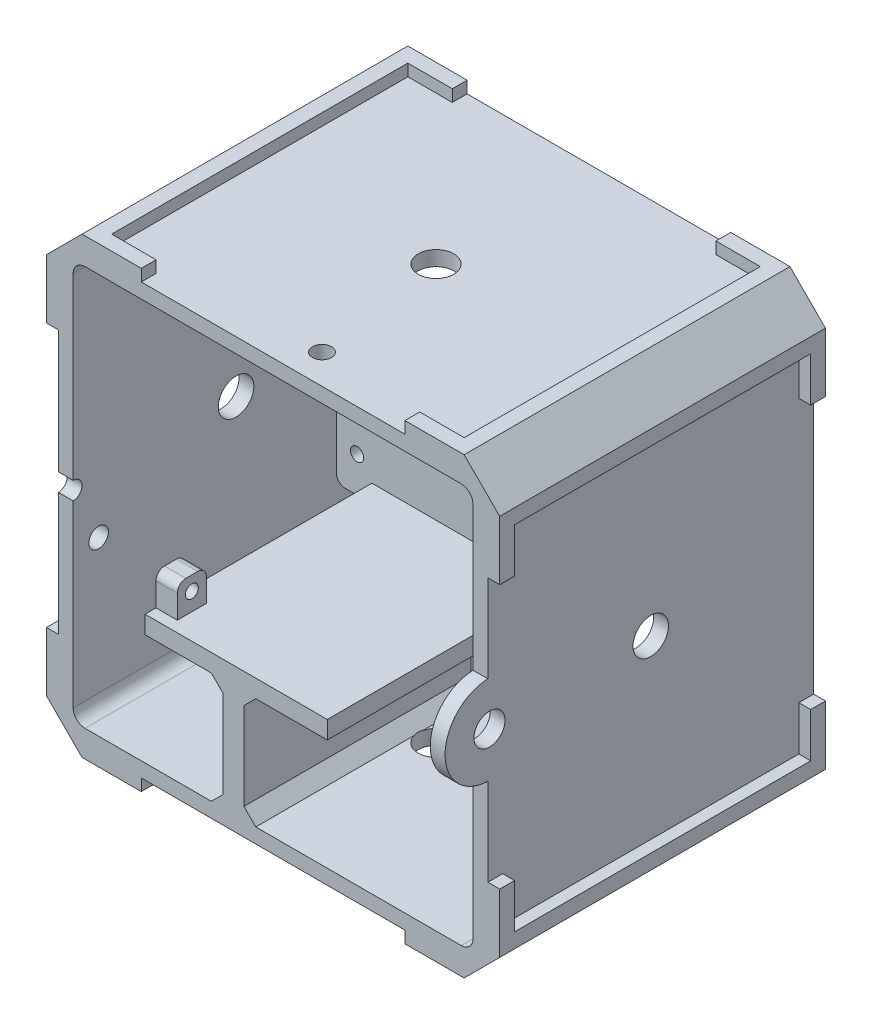
from build123d import *

# Parameters (mm, degrees)
BOSS_EXTRUDE1_DEPTH             = 55
SKETCH2_W                       = 67.5
SKETCH2_H                       = 67.5
BOSS_EXTRUDE2_DEPTH             = 2.5
CUT_EXTRUDE2_REACH              = 77.187
SKETCH4_R                       = 1.65
MIRROR2_COPY_1_REACH            = 77.187
MIRROR2_COPY_1_SKETCH_R         = 1.65
BOSS_EXTRUDE3_DEPTH             = 14.6
BOSS_EXTRUDE3_DEPTH_BACK        = 25.8
BOSS_EXTRUDE4_DEPTH             = 49.7
SKETCH7_W                       = 37.9
SKETCH7_H                       = 22.75
CUT_EXTRUDE3_DEPTH              = 8.4
BOSS_EXTRUDE7_DEPTH             = 2
CUT_EXTRUDE6_REACH              = 84.442
CUT_EXTRUDE6_DIRECTION_2_DEPTH  = 83.442009922
CUT_EXTRUDE8_DEPTH              = 103.907106169
CUT_EXTRUDE8_DEPTH_BACK         = 2.5
SKETCH15_R                      = 1.6
SKETCH16_W                      = 7.5
SKETCH16_H                      = 1.65
BOSS_EXTRUDE8_DEPTH             = 7
CUT_EXTRUDE9_REACH              = 74.438
SKETCH17_R                      = 1.125
SKETCH19_R                      = 3
CUT_EXTRUDE10_DEPTH             = 2.5
BOSS_EXTRUDE9_DEPTH             = 2
CIRPATTERN1_COUNT               = 4
CIRPATTERN2_COUNT               = 4
BOSS_EXTRUDE12_DEPTH            = 55
CUT_EXTRUDE12_REACH             = 75.459
SKETCH23_W                      = 6.5
SKETCH23_H                      = 16
CHAMFER1_SIZE                   = 0.75
CUT_EXTRUDE13_REACH             = 91.486
SKETCH25_W                      = 3
SKETCH25_H                      = 35
SKETCH25_W_2                    = 5
SKETCH25_H_2                    = 46.7
FILLET3_R                       = 1.5
SKETCH26_W                      = 12.543976605
SKETCH26_H                      = 9.586128164
CUT_EXTRUDE14_DEPTH             = 89.806325225
SKETCH27_W                      = 6.75
SKETCH27_H                      = 1.4
BOSS_EXTRUDE14_DEPTH            = 1.25
CHAMFER2_SIZE                   = 2
CUT_EXTRUDE15_REACH             = 85.744
SKETCH28_W                      = 7.624106446
SKETCH28_H                      = 46.373052842
SKETCH29_W                      = 40.4
SKETCH29_H                      = 3
BOSS_EXTRUDE15_DEPTH            = 18.75
BOSS_EXTRUDE16_DEPTH            = 4
CHAMFER3_SIZE                   = 0.75
CHAMFER3_OF_MIRROR3_SIZE        = 0.75
MIRROR4_START                   = 2.5
MIRROR4_DEPTH                   = 4
CUT_EXTRUDE16_REACH             = 102.191
SKETCH32_R                      = 1.5
CUT_EXTRUDE16_DIRECTION_2_DEPTH = 101.19137937
BOSS_EXTRUDE17_DEPTH            = 5
CUT_EXTRUDE17_REACH             = 68.28
SKETCH37_W                      = 5
SKETCH37_H                      = 18.75
SKETCH37_W_2                    = 5.265
BOSS_EXTRUDE18_DEPTH            = 5
BOSS_EXTRUDE19_DEPTH            = 3
FILLET4_R                       = 1.5
FILLET5_R                       = 1.5
SKETCH38_R                      = 1.1
BOSS_EXTRUDE20_DEPTH            = 3.6
SKETCH39_R                      = 1.75
CUT_EXTRUDE18_DEPTH             = 1.4
CUT_EXTRUDE19_REACH             = 102.191
SKETCH40_R                      = 1.65
SKETCH42_R                      = 7.5
SKETCH42_R_2                    = 2.625
BOSS_EXTRUDE22_DEPTH            = 2.5
CUT_EXTRUDE20_REACH             = 106.329
SKETCH43_R                      = 2.625


with BuildPart() as part:
    # Sketch1 → Boss-Extrude1 (new body)
    with BuildSketch(Plane.XY):
        with BuildLine():
            Line((-36.25, 32.25), (-36.25, -32.25))
            ThreePointArc((-36.25, -32.25), (-35.078427125, -35.078427125), (-32.25, -36.25))
            Line((-32.25, -36.25), (32.25, -36.25))
            ThreePointArc((32.25, -36.25), (35.078427125, -35.078427125), (36.25, -32.25))
            Line((36.25, -32.25), (36.25, 32.25))
            ThreePointArc((36.25, 32.25), (35.078427125, 35.078427125), (32.25, 36.25))
            Line((32.25, 36.25), (-32.25, 36.25))
            ThreePointArc((-32.25, 36.25), (-35.078427125, 35.078427125), (-36.25, 32.25))
        make_face()
        with BuildLine():
            Line((-31.75, 33.75), (31.75, 33.75))
            ThreePointArc((31.75, 33.75), (33.164213562, 33.164213562), (33.75, 31.75))
            Line((33.75, 31.75), (33.75, -31.75))
            ThreePointArc((33.75, -31.75), (33.164213562, -33.164213562), (31.75, -33.75))
            Line((31.75, -33.75), (-31.75, -33.75))
            ThreePointArc((-31.75, -33.75), (-33.164213562, -33.164213562), (-33.75, -31.75))
            Line((-33.75, -31.75), (-33.75, 31.75))
            ThreePointArc((-33.75, 31.75), (-33.164213562, 33.164213562), (-31.75, 33.75))
        make_face(mode=Mode.SUBTRACT)
    extrude(amount=BOSS_EXTRUDE1_DEPTH)

    # Sketch2 → Boss-Extrude2 (add)
    with BuildSketch(Plane.XY):
        Rectangle(SKETCH2_W, SKETCH2_H)
    extrude(amount=BOSS_EXTRUDE2_DEPTH)

    # Sketch4 → Cut-Extrude2 (cut, up to next)
    with BuildSketch(Plane(origin=(0, 0, 0), x_dir=(-1, 0, 0), z_dir=(0, 0, -1)), mode=Mode.PRIVATE) as cut_extrude2_sk1:
        with Locations((-28.75, 28.75)):
            Circle(SKETCH4_R)
    cut_extrude2_tool1 = extrude(cut_extrude2_sk1.sketch, amount=-CUT_EXTRUDE2_REACH, mode=Mode.PRIVATE) & part.part
    cut_extrude2 = cut_extrude2_tool1.solids().sort_by_distance((28.75, 28.75, 0))[0]
    add(cut_extrude2, mode=Mode.SUBTRACT)

    # Mirror1: Cut-Extrude2 across plane
    add(cut_extrude2.mirror(Plane(origin=(0, 0, 0), x_dir=(0, 0, 1), z_dir=(1, 0, 0))), mode=Mode.SUBTRACT)

    # Mirror2: Cut-Extrude2 across plane
    add(cut_extrude2.mirror(Plane.ZX), mode=Mode.SUBTRACT)

    # Mirror2 copy 1 sketch → Mirror2 copy 1 (cut, up to next)
    with BuildSketch(Plane(origin=(0, 0, 0), x_dir=(1, 0, 0), z_dir=(0, 0, -1)), mode=Mode.PRIVATE) as mirror2_copy_1_sk1:
        with Locations((-28.75, 28.75)):
            Circle(MIRROR2_COPY_1_SKETCH_R)
    mirror2_copy_1_tool1 = extrude(mirror2_copy_1_sk1.sketch, amount=-MIRROR2_COPY_1_REACH, mode=Mode.PRIVATE) & part.part
    add(mirror2_copy_1_tool1.solids().sort_by_distance((-28.75, -28.75, 0))[0], mode=Mode.SUBTRACT)



with BuildPart() as body_2:
    # Sketch5 → Boss-Extrude3 (new, two sides: drawn at the far end of the back side and taken through both)
    with BuildSketch(Plane(origin=(-0.82, 0, 0), x_dir=(0, 0, -1), z_dir=(1, 0, 0)).offset(-BOSS_EXTRUDE3_DEPTH_BACK)):
        Polygon((-16.7, 12), (-16.7, -12), (-60.4, -12), (-63.4, -12), (-63.4, -15), (-13.7, -15), (-13.7, 12), align=None)
    extrude(amount=BOSS_EXTRUDE3_DEPTH + BOSS_EXTRUDE3_DEPTH_BACK)


with BuildPart() as part_1:
    add(part.part)

    add(body_2.part)  # Boss-Extrude4 merges body 2
    # Sketch6 → Boss-Extrude4 (add)
    with BuildSketch(Plane.XY.offset(63.4)):
        Polygon((-26.62, -12), (11.28, -12), (11.28, -15), (-4.92, -15), (-4.92, -33.75), (11.28, -33.75), (11.28, -36.25), (-26.62, -36.25), (-26.62, -33.75), (-8.42, -33.75), (-8.42, -15), (-26.62, -15), align=None)
    extrude(amount=-BOSS_EXTRUDE4_DEPTH)

    # Sketch7 → Cut-Extrude3 (cut)
    with BuildSketch(Plane.XY.offset(63.4)):
        with Locations((-7.67, -24.875)):
            Rectangle(SKETCH7_W, SKETCH7_H)
    extrude(amount=-CUT_EXTRUDE3_DEPTH, mode=Mode.SUBTRACT)

    # Sketch12 → Boss-Extrude7 (add)
    with BuildSketch(Plane(origin=(0, 36.25, 0), x_dir=(1, 0, 0), z_dir=(0, 1, 0))):
        Polygon((29.75, -55), (32.25, -55), (32.25, -52.5), (32.25, -45), (29.75, -45), (29.75, -52.5), (22.25, -52.5), (22.25, -55), align=None)
        Polygon((-32.25, 0), (-32.25, -10), (-29.75, -10), (-29.75, -2.5), (-22.25, -2.5), (-22.25, 0), align=None)
    boss_extrude7 = extrude(amount=BOSS_EXTRUDE7_DEPTH)

    # Sketch13 → Cut-Extrude6 (cut, up to next)
    with BuildSketch(Plane(origin=(0, 0, 0), x_dir=(-1, 0, 0), z_dir=(0, 0, -1)), mode=Mode.PRIVATE) as cut_extrude6_sk1:
        with BuildLine():
            Line((-33.75, 21.25), (-25.25, 21.25))
            ThreePointArc((-25.25, 21.25), (-22.421572875, 22.421572875), (-21.25, 25.25))
            Line((-21.25, 25.25), (-21.25, 33.75))
            Line((-21.25, 33.75), (21.25, 33.75))
            Line((21.25, 33.75), (21.25, 25.25))
            ThreePointArc((21.25, 25.25), (22.421572875, 22.421572875), (25.25, 21.25))
            Line((25.25, 21.25), (33.75, 21.25))
            Line((33.75, 21.25), (33.75, -21.25))
            Line((33.75, -21.25), (25.25, -21.25))
            ThreePointArc((25.25, -21.25), (22.421572875, -22.421572875), (21.25, -25.25))
            Line((21.25, -25.25), (21.25, -33.75))
            Line((21.25, -33.75), (-21.25, -33.75))
            Line((-21.25, -33.75), (-21.25, -25.25))
            ThreePointArc((-21.25, -25.25), (-22.421572875, -22.421572875), (-25.25, -21.25))
            Line((-25.25, -21.25), (-33.75, -21.25))
            Line((-33.75, -21.25), (-33.75, 21.25))
        make_face()
    cut_extrude6_tool1 = extrude(cut_extrude6_sk1.sketch, amount=-CUT_EXTRUDE6_REACH, mode=Mode.PRIVATE) & part_1.part
    add(cut_extrude6_tool1.solids().sort_by_distance((0, 0, 0))[0], mode=Mode.SUBTRACT)

    # Sketch13 → Cut-Extrude6 direction 2 (cut)
    with BuildSketch(Plane(origin=(0, 0, 0), x_dir=(-1, 0, 0), z_dir=(0, 0, -1))):
        with BuildLine():
            Line((-33.75, 21.25), (-25.25, 21.25))
            ThreePointArc((-25.25, 21.25), (-22.421572875, 22.421572875), (-21.25, 25.25))
            Line((-21.25, 25.25), (-21.25, 33.75))
            Line((-21.25, 33.75), (21.25, 33.75))
            Line((21.25, 33.75), (21.25, 25.25))
            ThreePointArc((21.25, 25.25), (22.421572875, 22.421572875), (25.25, 21.25))
            Line((25.25, 21.25), (33.75, 21.25))
            Line((33.75, 21.25), (33.75, -21.25))
            Line((33.75, -21.25), (25.25, -21.25))
            ThreePointArc((25.25, -21.25), (22.421572875, -22.421572875), (21.25, -25.25))
            Line((21.25, -25.25), (21.25, -33.75))
            Line((21.25, -33.75), (-21.25, -33.75))
            Line((-21.25, -33.75), (-21.25, -25.25))
            ThreePointArc((-21.25, -25.25), (-22.421572875, -22.421572875), (-25.25, -21.25))
            Line((-25.25, -21.25), (-33.75, -21.25))
            Line((-33.75, -21.25), (-33.75, 21.25))
        make_face()
    extrude(amount=CUT_EXTRUDE6_DIRECTION_2_DEPTH, mode=Mode.SUBTRACT)

    # Sketch15 → Cut-Extrude8 (cut, two sides: drawn at the far end of the back side and taken through both)
    with BuildSketch(Plane(origin=(0, 36.25, 0), x_dir=(1, 0, 0), z_dir=(0, 1, 0)).offset(-CUT_EXTRUDE8_DEPTH_BACK)):
        with Locations(Location((3.25, -50, 0), (0, 0, 270))):
            Circle(SKETCH15_R)
    extrude(amount=CUT_EXTRUDE8_DEPTH + CUT_EXTRUDE8_DEPTH_BACK, mode=Mode.SUBTRACT)

    # Sketch16 → Boss-Extrude8 (add)
    with BuildSketch(Plane(origin=(-33.75, 0, 0), x_dir=(0, 0, -1), z_dir=(1, 0, 0))):
        with Locations((-16.5, 29.525)):
            Rectangle(SKETCH16_W, SKETCH16_H)
    extrude(amount=BOSS_EXTRUDE8_DEPTH)

    # Sketch17 → Cut-Extrude9 (cut, up to next)
    with BuildSketch(Plane(origin=(0, 0, 13.7), x_dir=(-1, 0, 0), z_dir=(0, 0, -1)), mode=Mode.PRIVATE) as cut_extrude9_sk1:
        with Locations(Location((-11.28, 9, 0), (0, 0, 90))):
            Circle(SKETCH17_R)
    cut_extrude9_tool1 = extrude(cut_extrude9_sk1.sketch, amount=-CUT_EXTRUDE9_REACH, mode=Mode.PRIVATE) & part_1.part
    # Sketch17 → Cut-Extrude9 (cut, up to next)
    with BuildSketch(Plane(origin=(0, 0, 13.7), x_dir=(-1, 0, 0), z_dir=(0, 0, -1)), mode=Mode.PRIVATE) as cut_extrude9_sk2:
        with Locations(Location((-11.28, -9, 0), (0, 0, 90))):
            Circle(SKETCH17_R)
    cut_extrude9_tool2 = extrude(cut_extrude9_sk2.sketch, amount=-CUT_EXTRUDE9_REACH, mode=Mode.PRIVATE) & part_1.part
    # Sketch17 → Cut-Extrude9 (cut, up to next)
    with BuildSketch(Plane(origin=(0, 0, 13.7), x_dir=(-1, 0, 0), z_dir=(0, 0, -1)), mode=Mode.PRIVATE) as cut_extrude9_sk3:
        with Locations(Location((24.12, -9, 0), (0, 0, 90))):
            Circle(SKETCH17_R)
    cut_extrude9_tool3 = extrude(cut_extrude9_sk3.sketch, amount=-CUT_EXTRUDE9_REACH, mode=Mode.PRIVATE) & part_1.part
    add(cut_extrude9_tool1.solids().sort_by_distance((11.28, 9, 13.7))[0], mode=Mode.SUBTRACT)
    add(cut_extrude9_tool2.solids().sort_by_distance((11.28, -9, 13.7))[0], mode=Mode.SUBTRACT)
    add(cut_extrude9_tool3.solids().sort_by_distance((-24.12, -9, 13.7))[0], mode=Mode.SUBTRACT)

    # Sketch19 → Cut-Extrude10 (cut)
    with BuildSketch(Plane(origin=(0, 36.25, 0), x_dir=(1, 0, 0), z_dir=(0, 1, 0))):
        with Locations(Location((0, -27.5, 0), (0, 0, 270))):
            Circle(SKETCH19_R)
    cut_extrude10 = extrude(amount=-CUT_EXTRUDE10_DEPTH, mode=Mode.SUBTRACT)

    # Sketch20 → Boss-Extrude9 (add)
    with BuildSketch(Plane(origin=(36.25, 0, -36.25), x_dir=(0, 0, 1), z_dir=(-1, 0, 0))):
        Polygon((91.25, 32.25), (81.25, 32.25), (81.25, 29.75), (88.75, 29.75), (88.75, 22.25), (91.25, 22.25), align=None)
        Polygon((36.25, -22.25), (36.25, -32.25), (46.25, -32.25), (46.25, -29.75), (38.75, -29.75), (38.75, -22.25), align=None)
    boss_extrude9 = extrude(amount=-BOSS_EXTRUDE9_DEPTH)

    # CirPattern1: Boss-Extrude7, Cut-Extrude10 ×4 about axis
    cirpattern1_axis = Axis((0, 0, 0), (0, 0, 1))
    add([boss_extrude7.rotate(cirpattern1_axis, i * 360 / CIRPATTERN1_COUNT) for i in range(1, CIRPATTERN1_COUNT)])
    add([cut_extrude10.rotate(cirpattern1_axis, i * 360 / CIRPATTERN1_COUNT) for i in range(1, CIRPATTERN1_COUNT)], mode=Mode.SUBTRACT)

    # CirPattern2: Boss-Extrude9 ×4 about axis
    cirpattern2_axis = Axis((0, 0, 0), (0, 0, 1))
    for i in range(1, CIRPATTERN2_COUNT):
        add(boss_extrude9.rotate(cirpattern2_axis, i * 360 / CIRPATTERN2_COUNT))

    # Sketch22 → Boss-Extrude12 (add, through all)
    with BuildSketch(Plane.XY.offset(55)):
        Polygon((-38.25, 32.25), (-32.25, 38.25), (-29.75, 38.25), (-29.75, 33.75), (-33.75, 33.75), (-33.75, 29.75), (-38.25, 29.75), align=None)
        Polygon((33.75, 33.75), (33.75, 29.75), (38.25, 29.75), (38.25, 32.25), (32.25, 38.25), (29.75, 38.25), (29.75, 33.75), align=None)
        Polygon((38.25, -32.25), (32.25, -38.25), (29.75, -38.25), (29.75, -33.75), (33.75, -33.75), (33.75, -29.75), (38.25, -29.75), align=None)
        Polygon((-33.75, -33.75), (-33.75, -29.75), (-38.25, -29.75), (-38.25, -32.25), (-32.25, -38.25), (-29.75, -38.25), (-29.75, -33.75), align=None)
    extrude(amount=-BOSS_EXTRUDE12_DEPTH)

    # Sketch23 → Cut-Extrude12 (cut, up to next)
    with BuildSketch(Plane(origin=(0, 0, 13.7), x_dir=(-1, 0, 0), z_dir=(0, 0, -1)), mode=Mode.PRIVATE) as cut_extrude12_sk1:
        with Locations((23.37, 4)):
            Rectangle(SKETCH23_W, SKETCH23_H)
    cut_extrude12_tool1 = extrude(cut_extrude12_sk1.sketch, amount=-CUT_EXTRUDE12_REACH, mode=Mode.PRIVATE) & part_1.part
    add(cut_extrude12_tool1.solids().sort_by_distance((-23.37, 4, 13.7))[0], mode=Mode.SUBTRACT)

    # Chamfer1
    chamfer1_edges = [part_1.edges().sort_by_distance(p)[0] for p in [
        (-33.75, 28.7, 16.5),
        (-30.25, 30.35, 20.25),
        (-26.75, 30.35, 16.5),
    ]]
    chamfer(chamfer1_edges, length=CHAMFER1_SIZE)

    # Sketch25 → Cut-Extrude13 (cut, up to next)
    with BuildSketch(Plane(origin=(0, -12, 0), x_dir=(1, 0, 0), z_dir=(0, 1, 0)), mode=Mode.PRIVATE) as cut_extrude13_sk1:
        with Locations((12.28, -45.9)):
            Rectangle(SKETCH25_W, SKETCH25_H)
    cut_extrude13_tool1 = extrude(cut_extrude13_sk1.sketch, amount=-CUT_EXTRUDE13_REACH, mode=Mode.PRIVATE) & part_1.part
    # Sketch25 → Cut-Extrude13 (cut, up to next)
    with BuildSketch(Plane(origin=(0, -12, 0), x_dir=(1, 0, 0), z_dir=(0, 1, 0)), mode=Mode.PRIVATE) as cut_extrude13_sk2:
        with Locations((-24.12, -40.05)):
            Rectangle(SKETCH25_W_2, SKETCH25_H_2)
    cut_extrude13_tool2 = extrude(cut_extrude13_sk2.sketch, amount=-CUT_EXTRUDE13_REACH, mode=Mode.PRIVATE) & part_1.part
    add(cut_extrude13_tool1.solids().sort_by_distance((12.28, -12, 45.9))[0], mode=Mode.SUBTRACT)
    add(cut_extrude13_tool2.solids().sort_by_distance((-24.12, -12, 40.05))[0], mode=Mode.SUBTRACT)

    # Fillet3
    fillet3_edges = [part_1.edges().sort_by_distance(p)[0] for p in [
        (-20.12, -4, 15.2),
        (-20.12, 12, 15.2),
        (-26.62, -4, 15.2),
    ]]
    fillet(fillet3_edges, radius=FILLET3_R)

    # Sketch26 → Cut-Extrude14 (cut, through all)
    with BuildSketch(Plane(origin=(10.78, 0, 0), x_dir=(0, 0, -1), z_dir=(1, 0, 0))):
        with Locations((-61.271988302, -13.249120227)):
            Rectangle(SKETCH26_W, SKETCH26_H)
    extrude(amount=-CUT_EXTRUDE14_DEPTH, mode=Mode.SUBTRACT)

    # Sketch27 → Boss-Extrude14 (add)
    with BuildSketch(Plane(origin=(-33.75, 0, 0), x_dir=(0, 0, -1), z_dir=(1, 0, 0))):
        with Locations((-16.125, 31.05)):
            Rectangle(SKETCH27_W, SKETCH27_H)
    extrude(amount=BOSS_EXTRUDE14_DEPTH)

    # Chamfer2
    # the kernel refuses this chamfer: 2 mm, written as the material it adds along each edge
    with BuildSketch(Plane(origin=(-4.92, -33.75, 13.7), x_dir=(1, 0, 0), z_dir=(0, 0, 1))) as chamfer2_piece_1_section:
        Polygon((CHAMFER2_SIZE, 0), (0, CHAMFER2_SIZE), (0, 0), align=None)
    chamfer2_piece_1 = extrude(amount=41.3, mode=Mode.PRIVATE)
    chamfer2_piece_1 = chamfer2_piece_1 - Plane(origin=(0, -33.75, 27.5), x_dir=(0, 0, 1), z_dir=(0, -1, 0)) * Cylinder(3, 91, mode=Mode.PRIVATE)
    add(chamfer2_piece_1)
    with BuildSketch(Plane(origin=(-4.92, -15, 55), x_dir=(0, -1, 0), z_dir=(0, 0, -1)), Plane(origin=(-8.42, -33.75, 55), x_dir=(0, 1, 0), z_dir=(0, 0, -1))) as chamfer2_piece_2:
        Polygon((CHAMFER2_SIZE, 0), (0, -CHAMFER2_SIZE), (0, 0), align=None)
    extrude(amount=41.3)
    with BuildSketch(Plane(origin=(-8.42, -15, 55), x_dir=(0, -1, 0), z_dir=(0, 0, -1))) as chamfer2_piece_3:
        Polygon((CHAMFER2_SIZE, 0), (0, CHAMFER2_SIZE), (0, 0), align=None)
    extrude(amount=41.3)

    # Sketch28 → Cut-Extrude15 (cut, up to next)
    with BuildSketch(Plane(origin=(0, -12, 0), x_dir=(1, 0, 0), z_dir=(0, 1, 0)), mode=Mode.PRIVATE) as cut_extrude15_sk1:
        with Locations((12.962053223, -39.886526421)):
            Rectangle(SKETCH28_W, SKETCH28_H)
    cut_extrude15_tool1 = extrude(cut_extrude15_sk1.sketch, amount=-CUT_EXTRUDE15_REACH, mode=Mode.PRIVATE) & part_1.part
    add(cut_extrude15_tool1.solids().sort_by_distance((12.962053, -12, 39.886526))[0], mode=Mode.SUBTRACT)

    # Sketch29 → Boss-Extrude15 (add)
    with BuildSketch(Plane(origin=(0, -15, 0), x_dir=(-1, 0, 0), z_dir=(0, -1, 0))):
        with Locations((6.42, -15.2)):
            Rectangle(SKETCH29_W, SKETCH29_H)
    extrude(amount=BOSS_EXTRUDE15_DEPTH)

    # Sketch31 → Boss-Extrude16 (add)
    with BuildSketch(Plane.XY.offset(2.5)):
        with BuildLine():
            Line((-33.75, 21.25), (-33.75, 33.75))
            Line((-33.75, 33.75), (-21.25, 33.75))
            Line((-21.25, 33.75), (-21.25, 25.25))
            ThreePointArc((-21.25, 25.25), (-22.421572875, 22.421572875), (-25.25, 21.25))
            Line((-25.25, 21.25), (-33.75, 21.25))
        make_face()
        Polygon((-28.75, 32.069764048), (-31.625, 30.409882024), (-31.625, 27.090117976), (-28.75, 25.430235952), (-25.875, 27.090117976), (-25.875, 30.409882024), align=None, mode=Mode.SUBTRACT)
    boss_extrude16 = extrude(amount=BOSS_EXTRUDE16_DEPTH)

    # Chamfer3
    chamfer3_edges = [part_1.edges().sort_by_distance(p)[0] for p in [
        (-27.3125, 31.239823036, 6.5),
        (-30.1875, 31.239823036, 6.5),
        (-31.625, 28.75, 6.5),
        (-30.1875, 26.260176964, 6.5),
        (-27.3125, 26.260176964, 6.5),
        (-25.875, 28.75, 6.5),
    ]]
    chamfer(chamfer3_edges, length=CHAMFER3_SIZE)

    # Mirror3: Boss-Extrude16 across plane
    add(boss_extrude16.mirror(Plane(origin=(0, 0, 0), x_dir=(0, 0, 1), z_dir=(1, 0, 0))))

    # Chamfer3 of Mirror3
    chamfer3_of_mirror3_edges = [part_1.edges().sort_by_distance(p)[0] for p in [
        (27.3125, 31.239823036, 6.5),
        (30.1875, 31.239823036, 6.5),
        (31.625, 28.75, 6.5),
        (30.1875, 26.260176964, 6.5),
        (27.3125, 26.260176964, 6.5),
        (25.875, 28.75, 6.5),
    ]]
    chamfer(chamfer3_of_mirror3_edges, length=CHAMFER3_OF_MIRROR3_SIZE)

    # Mirror4: read off the stored shape, not the designer's step
    # Mirror4 outline → Mirror4 (add)
    # profile 1 of 2: a face of its own
    with BuildSketch(Plane.XY.offset(MIRROR4_START)):
        with BuildLine():
            Line((33.75, -31.75), (33.75, -21.25))
            Line((33.75, -21.25), (25.25, -21.25))
            ThreePointArc((25.25, -21.25), (22.421572875, -22.421572875), (21.25, -25.25))
            Line((21.25, -25.25), (21.25, -33.75))
            Line((21.25, -33.75), (31.75, -33.75))
            ThreePointArc((31.75, -33.75), (33.164213562, -33.164213562), (33.75, -31.75))
        make_face()
        Polygon((28.75, -32.069764048), (25.875, -30.409882024), (25.875, -27.090117976), (28.75, -25.430235952), (31.625, -27.090117976), (31.625, -30.409882024), align=None, mode=Mode.SUBTRACT)
    # profile 2 of 2: a face of its own
    with BuildSketch(Plane.XY.offset(MIRROR4_START)):
        with BuildLine():
            Line((-31.75, -33.75), (-21.25, -33.75))
            Line((-21.25, -33.75), (-21.25, -25.25))
            ThreePointArc((-21.25, -25.25), (-22.421572875, -22.421572875), (-25.25, -21.25))
            Line((-25.25, -21.25), (-33.75, -21.25))
            Line((-33.75, -21.25), (-33.75, -31.75))
            ThreePointArc((-33.75, -31.75), (-33.164213562, -33.164213562), (-31.75, -33.75))
        make_face()
        Polygon((-31.625, -30.409882024), (-31.625, -27.090117976), (-28.75, -25.430235952), (-25.875, -27.090117976), (-25.875, -30.409882024), (-28.75, -32.069764048), align=None, mode=Mode.SUBTRACT)
    extrude(amount=MIRROR4_DEPTH)

    # Mirror4 2: loft between two sections, ruled curve by curve
    mirror4_2_from = [
        Edge.make_line((-25.875, -27.090117976, 5.75), (-25.875, -30.409882024, 5.75)),
        Edge.make_line((-31.625, -30.409882024, 5.75), (-31.625, -27.090117976, 5.75)),
        Edge.make_line((-25.875, -30.409882024, 5.75), (-28.75, -32.069764048, 5.75)),
        Edge.make_line((-25.875, -27.090117976, 5.75), (-28.75, -25.430235952, 5.75)),
        Edge.make_line((-28.75, -32.069764048, 5.75), (-31.625, -30.409882024, 5.75)),
        Edge.make_line((-28.75, -25.430235952, 5.75), (-31.625, -27.090117976, 5.75)),
    ]
    mirror4_2_to = [
        Edge.make_line((-25.125, -26.657105274, 6.5), (-25.125, -30.842894726, 6.5)),
        Edge.make_line((-32.375, -30.842894726, 6.5), (-32.375, -26.657105274, 6.5)),
        Edge.make_line((-25.125, -30.842894726, 6.5), (-28.75, -32.935789452, 6.5)),
        Edge.make_line((-25.125, -26.657105274, 6.5), (-28.75, -24.564210548, 6.5)),
        Edge.make_line((-28.75, -32.935789452, 6.5), (-32.375, -30.842894726, 6.5)),
        Edge.make_line((-28.75, -24.564210548, 6.5), (-32.375, -26.657105274, 6.5)),
    ]
    mirror4_2 = Solid(Shell([*[Face.make_surface_from_curves(mirror4_2_from[k], mirror4_2_to[k]) for k in range(6)], Face(Wire(mirror4_2_from)), Face(Wire(mirror4_2_to))]))
    add(mirror4_2, mode=Mode.SUBTRACT)

    # Mirror4 3: loft between two sections, ruled curve by curve
    mirror4_3_from = [
        Edge.make_line((25.875, -27.090117976, 5.75), (25.875, -30.409882024, 5.75)),
        Edge.make_line((31.625, -30.409882024, 5.75), (31.625, -27.090117976, 5.75)),
        Edge.make_line((25.875, -30.409882024, 5.75), (28.75, -32.069764048, 5.75)),
        Edge.make_line((25.875, -27.090117976, 5.75), (28.75, -25.430235952, 5.75)),
        Edge.make_line((28.75, -32.069764048, 5.75), (31.625, -30.409882024, 5.75)),
        Edge.make_line((28.75, -25.430235952, 5.75), (31.625, -27.090117976, 5.75)),
    ]
    mirror4_3_to = [
        Edge.make_line((25.125, -26.657105274, 6.5), (25.125, -30.842894726, 6.5)),
        Edge.make_line((32.375, -30.842894726, 6.5), (32.375, -26.657105274, 6.5)),
        Edge.make_line((25.125, -30.842894726, 6.5), (28.75, -32.935789452, 6.5)),
        Edge.make_line((25.125, -26.657105274, 6.5), (28.75, -24.564210548, 6.5)),
        Edge.make_line((28.75, -32.935789452, 6.5), (32.375, -30.842894726, 6.5)),
        Edge.make_line((28.75, -24.564210548, 6.5), (32.375, -26.657105274, 6.5)),
    ]
    mirror4_3 = Solid(Shell([*[Face.make_surface_from_curves(mirror4_3_from[k], mirror4_3_to[k]) for k in range(6)], Face(Wire(mirror4_3_from)), Face(Wire(mirror4_3_to))]))
    add(mirror4_3, mode=Mode.SUBTRACT)

    # Sketch32 → Cut-Extrude16 (cut, up to next)
    with BuildSketch(Plane.ZY.offset(36.25), mode=Mode.PRIVATE) as cut_extrude16_sk1:
        with Locations((55, 0)):
            Circle(SKETCH32_R)
    cut_extrude16_tool1 = extrude(cut_extrude16_sk1.sketch, amount=-CUT_EXTRUDE16_REACH, mode=Mode.PRIVATE) & part_1.part
    add(cut_extrude16_tool1.solids().sort_by_distance((-36.25, 0, 55))[0], mode=Mode.SUBTRACT)

    # Sketch32 → Cut-Extrude16 direction 2 (cut)
    with BuildSketch(Plane.ZY.offset(36.25)):
        with Locations((55, 0)):
            Circle(SKETCH32_R)
    extrude(amount=CUT_EXTRUDE16_DIRECTION_2_DEPTH, mode=Mode.SUBTRACT)

    # Sketch34 → Boss-Extrude17 (add)
    with BuildSketch(Plane(origin=(0, -2.5, 0), x_dir=(1, 0, 0), z_dir=(0, 1, 0))):
        Polygon((33.75, 0), (26.25, 0), (26.25, -5), (28.25, -5), (28.25, -2), (33.75, -2), align=None)
    extrude(amount=BOSS_EXTRUDE17_DEPTH)

    # Sketch37 → Cut-Extrude17 (cut, up to next)
    with BuildSketch(Plane.XY.offset(16.7), mode=Mode.PRIVATE) as cut_extrude17_sk1:
        with Locations((-24.12, -24.375)):
            Rectangle(SKETCH37_W, SKETCH37_H)
    cut_extrude17_tool1 = extrude(cut_extrude17_sk1.sketch, amount=-CUT_EXTRUDE17_REACH, mode=Mode.PRIVATE) & part_1.part
    # Sketch37 → Cut-Extrude17 (cut, up to next)
    with BuildSketch(Plane.XY.offset(16.7), mode=Mode.PRIVATE) as cut_extrude17_sk2:
        with Locations((11.7825, -24.375)):
            Rectangle(SKETCH37_W_2, SKETCH37_H)
    cut_extrude17_tool2 = extrude(cut_extrude17_sk2.sketch, amount=-CUT_EXTRUDE17_REACH, mode=Mode.PRIVATE) & part_1.part
    add(cut_extrude17_tool1.solids().sort_by_distance((-24.12, -24.375, 16.7))[0], mode=Mode.SUBTRACT)
    add(cut_extrude17_tool2.solids().sort_by_distance((11.7825, -24.375, 16.7))[0], mode=Mode.SUBTRACT)

    # Sketch35 → Boss-Extrude18 (add)
    with BuildSketch(Plane(origin=(0, -4.5, 0), x_dir=(1, 0, 0), z_dir=(0, 1, 0))):
        Polygon((28.25, 0), (28.25, -3), (33.75, -3), (33.75, -5), (26.25, -5), (26.25, 0), align=None)
    extrude(amount=-BOSS_EXTRUDE18_DEPTH)

    # Sketch36 → Boss-Extrude19 (add)
    with BuildSketch(Plane(origin=(0, 0, 13.7), x_dir=(-1, 0, 0), z_dir=(0, 0, -1))):
        Polygon((-14.78, 12.5), (-14.78, -15), (-13.78, -15), (-13.078054294, 9.964501053), (-8.498490792, 11.115288684), (18.340009821, -8.537374602), (25.611948328, -6.707928282), (26.62, -15), (27.62, -15), (27.62, -4), (20.12, 12.5), align=None)
    extrude(amount=-BOSS_EXTRUDE19_DEPTH)

    # Fillet4
    fillet4_edges = [part_1.edges().sort_by_distance(p)[0] for p in [
        (3.115, -33.75, 16.7),
        (-16.02, -33.75, 16.7),
        (-6.235, -33.75, 13.7),
        (-21.62, -33.75, 15.2),
        (9.15, -33.75, 15.2),
    ]]
    fillet(fillet4_edges, radius=FILLET4_R)

    # Fillet5
    # the kernel refuses this fillet: 1.5 mm, written as the material it adds along each edge
    with BuildSketch(Plane(origin=(-21.62, -15, 16.7), x_dir=(0, -1, 0), z_dir=(0, 0, -1))) as fillet5_piece_1:
        with BuildLine():
            CenterArc((FILLET5_R, FILLET5_R), FILLET5_R, 180, 90)
            Line((0, FILLET5_R), (0, 0))
            Line((0, 0), (FILLET5_R, 0))
        make_face()
    extrude(amount=3)
    with BuildSketch(Plane(origin=(9.15, -15, 16.7), x_dir=(0, -1, 0), z_dir=(0, 0, -1))) as fillet5_piece_2:
        with BuildLine():
            CenterArc((FILLET5_R, -FILLET5_R), FILLET5_R, 90, 90)
            Line((0, -FILLET5_R), (0, 0))
            Line((0, 0), (FILLET5_R, 0))
        make_face()
    extrude(amount=3)
    # the kernel refuses this fillet: 1.5 mm, written as the material it takes off along each edge
    with BuildSketch(Plane(origin=(-27.62, -15, 9.95), x_dir=(0, 1, 0), z_dir=(0, 0, 1)), Plane(origin=(14.78, 12.5, 9.95), x_dir=(0, -1, 0), z_dir=(0, 0, 1)), Plane(origin=(14.78, -15, 9.95), x_dir=(-1, 0, 0), z_dir=(0, 0, 1))) as fillet5_2_piece_1:
        with BuildLine():
            CenterArc((FILLET5_R, -FILLET5_R), FILLET5_R, 90, 90)
            Line((0, -FILLET5_R), (0, 0))
            Line((0, 0), (FILLET5_R, 0))
        make_face()
    extrude(amount=10.5, mode=Mode.SUBTRACT)
    with BuildSketch(Plane(origin=(-27.62, -4, 12.88771552), x_dir=(0.41380294430118375, 0.9103664774626048, 0), z_dir=(0, 0, 1))) as fillet5_2_piece_2:
        with BuildLine():
            CenterArc((FILLET5_R * 0.216609194719, -FILLET5_R), FILLET5_R, 90, 24.44395478)
            Line((-FILLET5_R * 0.197193749582, -FILLET5_R * 0.0896335225374), (0, 0))
            Line((0, 0), (FILLET5_R * 0.216609194719, 0))
        make_face()
    extrude(amount=4.62456896, mode=Mode.SUBTRACT)
    with BuildSketch(Plane(origin=(-20.12, 12.5, 11.285325236), x_dir=(1, 0, 0), z_dir=(0, 0, 1))) as fillet5_2_piece_3:
        with BuildLine():
            CenterArc((FILLET5_R * 0.643913270327, -FILLET5_R), FILLET5_R, 90, 65.55604522)
            Line((-FILLET5_R * 0.266453207136, -FILLET5_R * 0.586197055699), (0, 0))
            Line((0, 0), (FILLET5_R * 0.643913270327, 0))
        make_face()
    extrude(amount=7.829349527, mode=Mode.SUBTRACT)

    # Sketch38 → Boss-Extrude20 (add)
    with BuildSketch(Plane.ZY.offset(21.62)):
        with BuildLine():
            Line((48.25, -12), (53.15, -12))
            Line((53.15, -12), (53.15, -8.05))
            ThreePointArc((53.15, -8.05), (52.725304833, -7.024695167), (51.7, -6.6))
            Line((51.7, -6.6), (49.7, -6.6))
            ThreePointArc((49.7, -6.6), (48.674695167, -7.024695167), (48.25, -8.05))
            Line((48.25, -8.05), (48.25, -12))
        make_face()
        with Locations((50.7, -9)):
            Circle(SKETCH38_R, mode=Mode.SUBTRACT)
    extrude(amount=-BOSS_EXTRUDE20_DEPTH)

    # Sketch39 → Cut-Extrude18 (cut)
    with BuildSketch(Plane.ZY.offset(21.62)):
        with Locations((50.7, -9)):
            Circle(SKETCH39_R)
    extrude(amount=-CUT_EXTRUDE18_DEPTH, mode=Mode.SUBTRACT)

    # Sketch40 → Cut-Extrude19 (cut, up to next)
    with BuildSketch(Plane.ZY.offset(36.25), mode=Mode.PRIVATE) as cut_extrude19_sk1:
        with Locations((50.7, -9)):
            Circle(SKETCH40_R)
    cut_extrude19_tool1 = extrude(cut_extrude19_sk1.sketch, amount=-CUT_EXTRUDE19_REACH, mode=Mode.PRIVATE) & part_1.part
    add(cut_extrude19_tool1.solids().sort_by_distance((-36.25, -9, 50.7))[0], mode=Mode.SUBTRACT)

    # Sketch42 → Boss-Extrude22 (add)
    with BuildSketch(Plane(origin=(36.25, 0, 0), x_dir=(0, 0, -1), z_dir=(1, 0, 0))):
        with Locations((-54.72, 0)):
            Circle(SKETCH42_R)
        with Locations((-54.72, 0)):
            Circle(SKETCH42_R_2, mode=Mode.SUBTRACT)
    extrude(amount=-BOSS_EXTRUDE22_DEPTH)

    # Sketch43 → Cut-Extrude20 (cut, up to next)
    with BuildSketch(Plane(origin=(36.25, 0, 0), x_dir=(0, 0, -1), z_dir=(1, 0, 0)), mode=Mode.PRIVATE) as cut_extrude20_sk1:
        with Locations((-54.72, 0)):
            Circle(SKETCH43_R)
    cut_extrude20_tool1 = extrude(cut_extrude20_sk1.sketch, amount=-CUT_EXTRUDE20_REACH, mode=Mode.PRIVATE) & part_1.part
    add(cut_extrude20_tool1.solids().sort_by_distance((36.25, 0, 54.72))[0], mode=Mode.SUBTRACT)


solid = part_1.part
